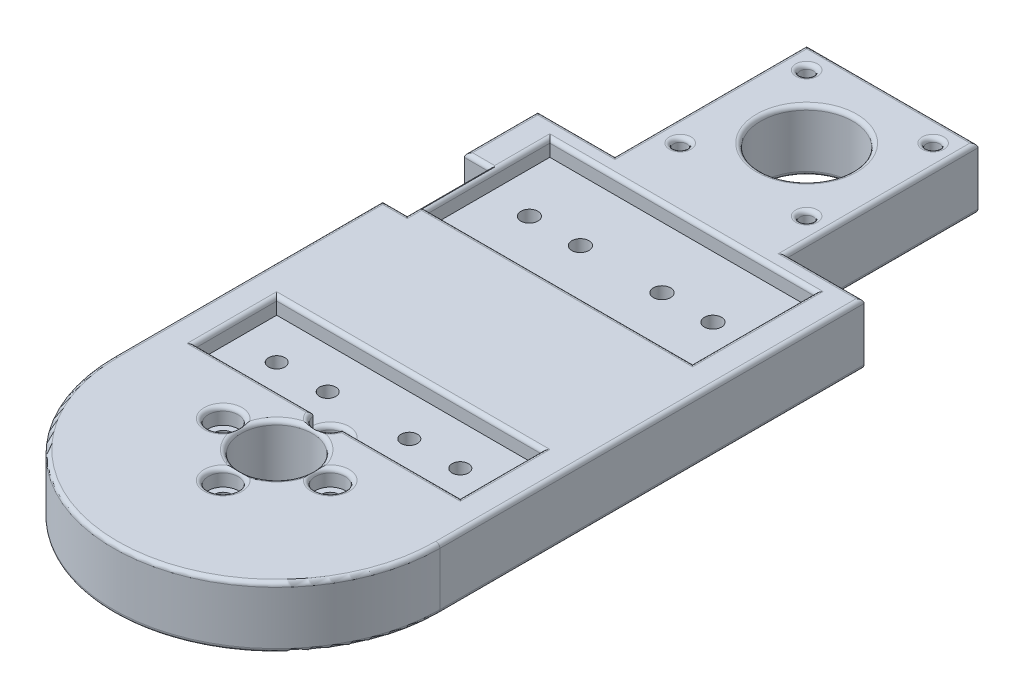
from build123d import *

# Parameters (mm, degrees)
SKIZZE1_W                        = 42
SKIZZE1_H                        = 47
SKIZZE1_R                        = 1.65
SKIZZE1_R_2                      = 11.3
SKIZZE1_R_3                      = 40
SKIZZE1_R_4                      = 17.5
SKIZZE1_R_5                      = 2.1
SKIZZE1_R_6                      = 8.75
AUFSATZ_LINEAR_AUSTRAGEN1_DEPTH  = 15
SCHNITT_LINEAR_AUSTRAGEN3_DEPTH  = 4
SKIZZE6_R                        = 2
SCHNITT_LINEAR_AUSTRAGEN4_DEPTH  = 11
SKIZZE14_W                       = 6
SKIZZE14_H                       = 20
SCHNITT_LINEAR_AUSTRAGEN11_DEPTH = 15
SKIZZE15_R                       = 2.25
SCHNITT_LINEAR_AUSTRAGEN12_DEPTH = 6
SKIZZE19_W                       = 65
SKIZZE19_H                       = 30
SCHNITT_LINEAR_AUSTRAGEN15_DEPTH = 4
SKIZZE21_R                       = 2.1
SCHNITT_LINEAR_AUSTRAGEN16_DEPTH = 11
SKIZZE22_R                       = 3.65
SCHNITT_LINEAR_AUSTRAGEN17_DEPTH = 4
SKIZZE23_R                       = 3
SKIZZE23_R_2                     = 11.3
SCHNITT_LINEAR_AUSTRAGEN18_DEPTH = 3
SKETCH5_R                        = 3.65
CUT_EXTRUDE3_DEPTH               = 4
SKIZZE24_R                       = 3.65
SCHNITT_LINEAR_AUSTRAGEN19_DEPTH = 4
VERRUNDUNG1_R                    = 1


with BuildPart() as part:
    # Skizze1 → Aufsatz-Linear austragen1 (new body)
    # profile 1 of 4: a face of its own
    with BuildSketch(Plane(origin=(0, 0, 0), x_dir=(1, 0, 0), z_dir=(0, 1, 0))):
        with Locations((-0.084777034, 127.5)):
            Rectangle(SKIZZE1_W, SKIZZE1_H)
        with Locations(Location((-15.584777034, 114.5, 0), (0, 0, 270))):
            Circle(SKIZZE1_R, mode=Mode.SUBTRACT)
        with Locations(Location((-15.584777034, 145.5, 0), (0, 0, 270))):
            Circle(SKIZZE1_R, mode=Mode.SUBTRACT)
        with Locations(Location((-0.084777034, 130, 0), (0, 0, 270))):
            Circle(SKIZZE1_R_2, mode=Mode.SUBTRACT)
        with Locations(Location((15.415222966, 114.5, 0), (0, 0, 270))):
            Circle(SKIZZE1_R, mode=Mode.SUBTRACT)
        with Locations(Location((15.415222966, 145.5, 0), (0, 0, 270))):
            Circle(SKIZZE1_R, mode=Mode.SUBTRACT)
    # profile 2 of 4: a face of its own
    with BuildSketch(Plane(origin=(0, 0, 0), x_dir=(1, 0, 0), z_dir=(0, 1, 0))):
        with BuildLine():
            Line((-40, 78), (-40, 0))
            ThreePointArc((-40, 0), (0, 40), (40, 0))
            Line((40, 0), (40, 104))
            Line((40, 104), (20.915222966, 104))
            Line((20.915222966, 104), (-21.084777034, 104))
            Line((-21.084777034, 104), (-40, 104))
            Line((-40, 104), (-40, 78))
        make_face()
    # profile 3 of 4: a face of its own
    with BuildSketch(Plane(origin=(0, 0, 0), x_dir=(1, 0, 0), z_dir=(0, 1, 0))):
        Circle(SKIZZE1_R_3)
        Circle(SKIZZE1_R_4, mode=Mode.SUBTRACT)
    # profile 4 of 4: a face of its own
    with BuildSketch(Plane(origin=(0, 0, 0), x_dir=(1, 0, 0), z_dir=(0, 1, 0))):
        Circle(SKIZZE1_R_4)
        with Locations(Location((-13.125, 0, 0), (0, 0, 270))):
            Circle(SKIZZE1_R_5, mode=Mode.SUBTRACT)
        with Locations(Location((0, -13.125, 0), (0, 0, 270))):
            Circle(SKIZZE1_R_5, mode=Mode.SUBTRACT)
        with Locations(Location((13.125, 0, 0), (0, 0, 270))):
            Circle(SKIZZE1_R_5, mode=Mode.SUBTRACT)
        with Locations(Location((0, 13.125, 0), (0, 0, 270))):
            Circle(SKIZZE1_R_5, mode=Mode.SUBTRACT)
        with Locations(Location((0, 0, 0), (0, 0, 270))):
            Circle(SKIZZE1_R_6, mode=Mode.SUBTRACT)
    extrude(amount=AUFSATZ_LINEAR_AUSTRAGEN1_DEPTH)

    # Skizze5 → Schnitt-Linear austragen3 (cut)
    with BuildSketch(Plane(origin=(0, 15, 0), x_dir=(1, 0, 0), z_dir=(0, 1, 0))):
        Polygon((32.5, 32.5), (-25, 32.5), (-32.5, 32.5), (-32.5, 12.5), (32.5, 12.5), align=None)
    extrude(amount=-SCHNITT_LINEAR_AUSTRAGEN3_DEPTH, mode=Mode.SUBTRACT)

    # Skizze6 → Schnitt-Linear austragen4 (cut)
    with BuildSketch(Plane(origin=(0, 11, 0), x_dir=(1, 0, 0), z_dir=(0, 1, 0))):
        with Locations(Location((10, 22.5, 0), (0, 0, 270))):
            Circle(SKIZZE6_R)
        with Locations(Location((-10, 22.5, 0), (0, 0, 90))):
            Circle(SKIZZE6_R)
        with Locations(Location((22.5, 22.5, 0), (0, 0, 270))):
            Circle(SKIZZE6_R)
        with Locations(Location((-22.5, 22.5, 0), (0, 0, 90))):
            Circle(SKIZZE6_R)
    extrude(amount=-SCHNITT_LINEAR_AUSTRAGEN4_DEPTH, mode=Mode.SUBTRACT)

    # Skizze14 → Schnitt-Linear austragen11 (cut)
    with BuildSketch(Plane(origin=(0, 15, 0), x_dir=(1, 0, 0), z_dir=(0, 1, 0))):
        with Locations((-37, 76)):
            Rectangle(SKIZZE14_W, SKIZZE14_H)
    extrude(amount=-SCHNITT_LINEAR_AUSTRAGEN11_DEPTH, mode=Mode.SUBTRACT)

    # Skizze15 → Schnitt-Linear austragen12 (cut)
    with BuildSketch(Plane.ZY.offset(34)):
        with Locations((-80.5, 7.5)):
            Circle(SKIZZE15_R)
        with Locations((-71, 7.5)):
            Circle(SKIZZE15_R)
    extrude(amount=-SCHNITT_LINEAR_AUSTRAGEN12_DEPTH, mode=Mode.SUBTRACT)

    # Skizze19 → Schnitt-Linear austragen15 (cut)
    with BuildSketch(Plane(origin=(0, 15, 0), x_dir=(1, 0, 0), z_dir=(0, 1, 0))):
        with Locations((-0.055105072, 84.5)):
            Rectangle(SKIZZE19_W, SKIZZE19_H)
    extrude(amount=-SCHNITT_LINEAR_AUSTRAGEN15_DEPTH, mode=Mode.SUBTRACT)

    # Skizze21 → Schnitt-Linear austragen16 (cut)
    with BuildSketch(Plane(origin=(0, 11, 0), x_dir=(1, 0, 0), z_dir=(0, 1, 0))):
        with Locations(Location((22.444894928, 84.5, 0), (0, 0, 270))):
            Circle(SKIZZE21_R)
        with Locations(Location((9.944894928, 84.5, 0), (0, 0, 270))):
            Circle(SKIZZE21_R)
        with Locations(Location((-22.554452941, 84.5, 0), (0, 0, 90))):
            Circle(SKIZZE21_R)
        with Locations(Location((-10.054452941, 84.5, 0), (0, 0, 90))):
            Circle(SKIZZE21_R)
    extrude(amount=-SCHNITT_LINEAR_AUSTRAGEN16_DEPTH, mode=Mode.SUBTRACT)

    # Skizze22 → Schnitt-Linear austragen17 (cut)
    with BuildSketch(Plane.XZ):
        with Locations(Location((-22.554452941, -84.5, 0), (0, 0, 270))):
            Circle(SKIZZE22_R)
        with Locations(Location((-10.054452941, -84.5, 0), (0, 0, 270))):
            Circle(SKIZZE22_R)
        with Locations(Location((10.054452941, -84.5, 0), (0, 0, 90))):
            Circle(SKIZZE22_R)
        with Locations(Location((22.554452941, -84.5, 0), (0, 0, 90))):
            Circle(SKIZZE22_R)
        with Locations(Location((-22.5, -22.5, 0), (0, 0, 270))):
            Circle(SKIZZE22_R)
        with Locations(Location((-10, -22.5, 0), (0, 0, 270))):
            Circle(SKIZZE22_R)
        with Locations(Location((10, -22.5, 0), (0, 0, 90))):
            Circle(SKIZZE22_R)
        with Locations(Location((22.5, -22.5, 0), (0, 0, 90))):
            Circle(SKIZZE22_R)
    extrude(amount=-SCHNITT_LINEAR_AUSTRAGEN17_DEPTH, mode=Mode.SUBTRACT)

    # Skizze23 → Schnitt-Linear austragen18 (cut)
    with BuildSketch(Plane.XZ):
        with Locations(Location((-15.584777034, -114.5, 0), (0, 0, 270))):
            Circle(SKIZZE23_R)
        with Locations(Location((-0.084777034, -130, 0), (0, 0, 90))):
            Circle(SKIZZE23_R_2)
        with Locations(Location((15.415222966, -114.5, 0), (0, 0, 270))):
            Circle(SKIZZE23_R)
        with Locations(Location((15.415222966, -145.5, 0), (0, 0, 270))):
            Circle(SKIZZE23_R)
        with Locations(Location((-15.584777034, -145.5, 0), (0, 0, 270))):
            Circle(SKIZZE23_R)
    extrude(amount=-SCHNITT_LINEAR_AUSTRAGEN18_DEPTH, mode=Mode.SUBTRACT)

    # Sketch5 → Cut-Extrude3 (cut)
    with BuildSketch(Plane(origin=(0, 15, 0), x_dir=(1, 0, 0), z_dir=(0, 1, 0))):
        with Locations(Location((-13.125, 0, 0), (0, 0, 270))):
            Circle(SKETCH5_R)
        with Locations((0, 13.125)):
            Circle(SKETCH5_R)
        with Locations(Location((13.125, 0, 0), (0, 0, 270))):
            Circle(SKETCH5_R)
        with Locations(Location((0, -13.125, 0), (0, 0, 270))):
            Circle(SKETCH5_R)
    extrude(amount=-CUT_EXTRUDE3_DEPTH, mode=Mode.SUBTRACT)

    # Skizze24 → Schnitt-Linear austragen19 (cut)
    with BuildSketch(Plane(origin=(0, 11, 0), x_dir=(1, 0, 0), z_dir=(0, 1, 0))):
        with Locations(Location((0, 13.125, 0), (0, 0, 270))):
            Circle(SKIZZE24_R)
    extrude(amount=-SCHNITT_LINEAR_AUSTRAGEN19_DEPTH, mode=Mode.SUBTRACT)

    # Verrundung1
    # the kernel refuses this fillet: 1 mm, written as the material it takes off along each edge
    with BuildSketch(Plane(origin=(0, 15, 0), x_dir=(0, 0, 1), z_dir=(-1, 0, 0))) as verrundung1_piece_1:
        with BuildLine():
            CenterArc((8.75 + VERRUNDUNG1_R, -VERRUNDUNG1_R), VERRUNDUNG1_R, 90, 90)
            Line((8.75, -VERRUNDUNG1_R), (8.75, 0))
            Line((8.75, 0), (8.75 + VERRUNDUNG1_R, 0))
        make_face()
    revolve(axis=Axis((0, 15, 0), (0, 1, 0)), mode=Mode.SUBTRACT)
    with BuildSketch(Plane(origin=(-40, 0, -106.5), x_dir=(1, 0, 0), z_dir=(0, 0, 1)), Plane(origin=(-40, 15, -83.5), x_dir=(1, 0, 0), z_dir=(0, 0, -1))) as verrundung1_piece_2:
        with BuildLine():
            CenterArc((VERRUNDUNG1_R, VERRUNDUNG1_R), VERRUNDUNG1_R, 180, 90)
            Line((0, VERRUNDUNG1_R), (0, 0))
            Line((0, 0), (VERRUNDUNG1_R, 0))
        make_face()
    extrude(amount=23, mode=Mode.SUBTRACT)
    with BuildSketch(Plane(origin=(-34, 0, -66), x_dir=(0, 0, 1), z_dir=(-1, 0, 0)), Plane(origin=(-42.5, 0, -86), x_dir=(0, 0, -1), z_dir=(1, 0, 0))) as verrundung1_piece_3:
        with BuildLine():
            CenterArc((VERRUNDUNG1_R, VERRUNDUNG1_R), VERRUNDUNG1_R, 180, 90)
            Line((0, VERRUNDUNG1_R), (0, 0))
            Line((0, 0), (VERRUNDUNG1_R, 0))
        make_face()
    extrude(amount=8.5, mode=Mode.SUBTRACT)
    with BuildSketch(Plane(origin=(-42.5, 15, -86), x_dir=(0, 0, -1), z_dir=(1, 0, 0)), Plane(origin=(-34, 15, -66), x_dir=(0, 0, 1), z_dir=(-1, 0, 0))) as verrundung1_piece_4:
        with BuildLine():
            CenterArc((VERRUNDUNG1_R, -VERRUNDUNG1_R), VERRUNDUNG1_R, 90, 90)
            Line((0, -VERRUNDUNG1_R), (0, 0))
            Line((0, 0), (VERRUNDUNG1_R, 0))
        make_face()
    extrude(amount=8.5, mode=Mode.SUBTRACT)
    with BuildSketch(Plane(origin=(-34, 15, -86), x_dir=(1, 0, 0), z_dir=(0, 0, 1))) as verrundung1_piece_5:
        with BuildLine():
            CenterArc((VERRUNDUNG1_R, -VERRUNDUNG1_R), VERRUNDUNG1_R, 90, 90)
            Line((0, -VERRUNDUNG1_R), (0, 0))
            Line((0, 0), (VERRUNDUNG1_R, 0))
        make_face()
    extrude(amount=20, mode=Mode.SUBTRACT)
    with BuildSketch(Plane(origin=(-34, 0, -86), x_dir=(1, 0, 0), z_dir=(0, 0, 1)), Plane(origin=(-32.5, 15, -32.5), x_dir=(-1, 0, 0), z_dir=(0, 0, 1)), Plane(origin=(32.5, 15, -12.5), x_dir=(1, 0, 0), z_dir=(0, 0, -1))) as verrundung1_piece_6:
        with BuildLine():
            CenterArc((VERRUNDUNG1_R, VERRUNDUNG1_R), VERRUNDUNG1_R, 180, 90)
            Line((0, VERRUNDUNG1_R), (0, 0))
            Line((0, 0), (VERRUNDUNG1_R, 0))
        make_face()
    extrude(amount=20, mode=Mode.SUBTRACT)
    with BuildSketch(Plane(origin=(32.444894928, 15, -69.5), x_dir=(1, 0, 0), z_dir=(0, 0, -1)), Plane(origin=(-32.555105072, 15, -99.5), x_dir=(-1, 0, 0), z_dir=(0, 0, 1))) as verrundung1_piece_7:
        with BuildLine():
            CenterArc((VERRUNDUNG1_R, VERRUNDUNG1_R), VERRUNDUNG1_R, 180, 90)
            Line((0, VERRUNDUNG1_R), (0, 0))
            Line((0, 0), (VERRUNDUNG1_R, 0))
        make_face()
    extrude(amount=30, mode=Mode.SUBTRACT)
    with BuildSketch(Plane(origin=(32.444894928, 15, -99.5), x_dir=(0, 0, -1), z_dir=(-1, 0, 0)), Plane(origin=(-32.555105072, 15, -69.5), x_dir=(0, 0, 1), z_dir=(1, 0, 0))) as verrundung1_piece_8:
        with BuildLine():
            CenterArc((VERRUNDUNG1_R, VERRUNDUNG1_R), VERRUNDUNG1_R, 180, 90)
            Line((0, VERRUNDUNG1_R), (0, 0))
            Line((0, 0), (VERRUNDUNG1_R, 0))
        make_face()
    extrude(amount=65, mode=Mode.SUBTRACT)
    with BuildSketch(Plane(origin=(-15.584777034, 15, -114.5), x_dir=(0, 0, 1), z_dir=(-1, 0, 0))) as verrundung1_piece_9:
        with BuildLine():
            CenterArc((1.65 + VERRUNDUNG1_R, -VERRUNDUNG1_R), VERRUNDUNG1_R, 90, 90)
            Line((1.65, -VERRUNDUNG1_R), (1.65, 0))
            Line((1.65, 0), (1.65 + VERRUNDUNG1_R, 0))
        make_face()
    revolve(axis=Axis((-15.584777034, 15, -114.5), (0, 1, 0)), mode=Mode.SUBTRACT)
    with BuildSketch(Plane(origin=(-22.5, 0, -22.5), x_dir=(0, 0, -1), z_dir=(-1, 0, 0))) as verrundung1_piece_10:
        with BuildLine():
            CenterArc((3.65 + VERRUNDUNG1_R, -VERRUNDUNG1_R), VERRUNDUNG1_R, 90, 90)
            Line((3.65, -VERRUNDUNG1_R), (3.65, 0))
            Line((3.65, 0), (3.65 + VERRUNDUNG1_R, 0))
        make_face()
    revolve(axis=Axis((-22.5, 0, -22.5), (0, -1, 0)), mode=Mode.SUBTRACT)
    with BuildSketch(Plane(origin=(22.554452941, 0, -84.5), x_dir=(0, 0, 1), z_dir=(1, 0, 0))) as verrundung1_piece_11:
        with BuildLine():
            CenterArc((3.65 + VERRUNDUNG1_R, -VERRUNDUNG1_R), VERRUNDUNG1_R, 90, 90)
            Line((3.65, -VERRUNDUNG1_R), (3.65, 0))
            Line((3.65, 0), (3.65 + VERRUNDUNG1_R, 0))
        make_face()
    revolve(axis=Axis((22.554452941, 0, -84.5), (0, -1, 0)), mode=Mode.SUBTRACT)
    with BuildSketch(Plane(origin=(10.054452941, 0, -84.5), x_dir=(0, 0, 1), z_dir=(1, 0, 0))) as verrundung1_piece_12:
        with BuildLine():
            CenterArc((3.65 + VERRUNDUNG1_R, -VERRUNDUNG1_R), VERRUNDUNG1_R, 90, 90)
            Line((3.65, -VERRUNDUNG1_R), (3.65, 0))
            Line((3.65, 0), (3.65 + VERRUNDUNG1_R, 0))
        make_face()
    revolve(axis=Axis((10.054452941, 0, -84.5), (0, -1, 0)), mode=Mode.SUBTRACT)
    with BuildSketch(Plane(origin=(15.415222966, 15, -114.5), x_dir=(0, 0, 1), z_dir=(-1, 0, 0))) as verrundung1_piece_13:
        with BuildLine():
            CenterArc((1.65 + VERRUNDUNG1_R, -VERRUNDUNG1_R), VERRUNDUNG1_R, 90, 90)
            Line((1.65, -VERRUNDUNG1_R), (1.65, 0))
            Line((1.65, 0), (1.65 + VERRUNDUNG1_R, 0))
        make_face()
    revolve(axis=Axis((15.415222966, 15, -114.5), (0, 1, 0)), mode=Mode.SUBTRACT)
    with BuildSketch(Plane(origin=(-10.054452941, 0, -84.5), x_dir=(0, 0, -1), z_dir=(-1, 0, 0))) as verrundung1_piece_14:
        with BuildLine():
            CenterArc((3.65 + VERRUNDUNG1_R, -VERRUNDUNG1_R), VERRUNDUNG1_R, 90, 90)
            Line((3.65, -VERRUNDUNG1_R), (3.65, 0))
            Line((3.65, 0), (3.65 + VERRUNDUNG1_R, 0))
        make_face()
    revolve(axis=Axis((-10.054452941, 0, -84.5), (0, -1, 0)), mode=Mode.SUBTRACT)
    with BuildSketch(Plane(origin=(-10, 0, -22.5), x_dir=(0, 0, -1), z_dir=(-1, 0, 0))) as verrundung1_piece_15:
        with BuildLine():
            CenterArc((3.65 + VERRUNDUNG1_R, -VERRUNDUNG1_R), VERRUNDUNG1_R, 90, 90)
            Line((3.65, -VERRUNDUNG1_R), (3.65, 0))
            Line((3.65, 0), (3.65 + VERRUNDUNG1_R, 0))
        make_face()
    revolve(axis=Axis((-10, 0, -22.5), (0, -1, 0)), mode=Mode.SUBTRACT)
    with BuildSketch(Plane(origin=(10, 0, -22.5), x_dir=(0, 0, 1), z_dir=(1, 0, 0))) as verrundung1_piece_16:
        with BuildLine():
            CenterArc((3.65 + VERRUNDUNG1_R, -VERRUNDUNG1_R), VERRUNDUNG1_R, 90, 90)
            Line((3.65, -VERRUNDUNG1_R), (3.65, 0))
            Line((3.65, 0), (3.65 + VERRUNDUNG1_R, 0))
        make_face()
    revolve(axis=Axis((10, 0, -22.5), (0, -1, 0)), mode=Mode.SUBTRACT)
    with BuildSketch(Plane(origin=(22.5, 0, -22.5), x_dir=(0, 0, 1), z_dir=(1, 0, 0))) as verrundung1_piece_17:
        with BuildLine():
            CenterArc((3.65 + VERRUNDUNG1_R, -VERRUNDUNG1_R), VERRUNDUNG1_R, 90, 90)
            Line((3.65, -VERRUNDUNG1_R), (3.65, 0))
            Line((3.65, 0), (3.65 + VERRUNDUNG1_R, 0))
        make_face()
    revolve(axis=Axis((22.5, 0, -22.5), (0, -1, 0)), mode=Mode.SUBTRACT)
    with BuildSketch(Plane(origin=(-22.554452941, 0, -84.5), x_dir=(0, 0, -1), z_dir=(-1, 0, 0))) as verrundung1_piece_18:
        with BuildLine():
            CenterArc((3.65 + VERRUNDUNG1_R, -VERRUNDUNG1_R), VERRUNDUNG1_R, 90, 90)
            Line((3.65, -VERRUNDUNG1_R), (3.65, 0))
            Line((3.65, 0), (3.65 + VERRUNDUNG1_R, 0))
        make_face()
    revolve(axis=Axis((-22.554452941, 0, -84.5), (0, -1, 0)), mode=Mode.SUBTRACT)
    with BuildSketch(Plane(origin=(0, 0, 0), x_dir=(0, 0, 1), z_dir=(-1, 0, 0))) as verrundung1_piece_19:
        with BuildLine():
            CenterArc((8.75 + VERRUNDUNG1_R, VERRUNDUNG1_R), VERRUNDUNG1_R, 180, 90)
            Line((8.75, VERRUNDUNG1_R), (8.75, 0))
            Line((8.75, 0), (8.75 + VERRUNDUNG1_R, 0))
        make_face()
    revolve(axis=Axis((0, 0, 0), (0, 1, 0)), mode=Mode.SUBTRACT)
    with BuildSketch(Plane(origin=(0, 0, -13.125), x_dir=(0, 0, 1), z_dir=(-1, 0, 0))) as verrundung1_piece_20:
        with BuildLine():
            CenterArc((2.1 + VERRUNDUNG1_R, VERRUNDUNG1_R), VERRUNDUNG1_R, 180, 90)
            Line((2.1, VERRUNDUNG1_R), (2.1, 0))
            Line((2.1, 0), (2.1 + VERRUNDUNG1_R, 0))
        make_face()
    revolve(axis=Axis((0, 0, -13.125), (0, 1, 0)), mode=Mode.SUBTRACT)
    with BuildSketch(Plane(origin=(13.125, 0, 0), x_dir=(0, 0, 1), z_dir=(-1, 0, 0))) as verrundung1_piece_21:
        with BuildLine():
            CenterArc((2.1 + VERRUNDUNG1_R, VERRUNDUNG1_R), VERRUNDUNG1_R, 180, 90)
            Line((2.1, VERRUNDUNG1_R), (2.1, 0))
            Line((2.1, 0), (2.1 + VERRUNDUNG1_R, 0))
        make_face()
    revolve(axis=Axis((13.125, 0, 0), (0, 1, 0)), mode=Mode.SUBTRACT)
    with BuildSketch(Plane(origin=(0, 0, 13.125), x_dir=(0, 0, 1), z_dir=(-1, 0, 0))) as verrundung1_piece_22:
        with BuildLine():
            CenterArc((2.1 + VERRUNDUNG1_R, VERRUNDUNG1_R), VERRUNDUNG1_R, 180, 90)
            Line((2.1, VERRUNDUNG1_R), (2.1, 0))
            Line((2.1, 0), (2.1 + VERRUNDUNG1_R, 0))
        make_face()
    revolve(axis=Axis((0, 0, 13.125), (0, 1, 0)), mode=Mode.SUBTRACT)
    with BuildSketch(Plane(origin=(-13.125, 0, 0), x_dir=(0, 0, 1), z_dir=(-1, 0, 0))) as verrundung1_piece_23:
        with BuildLine():
            CenterArc((2.1 + VERRUNDUNG1_R, VERRUNDUNG1_R), VERRUNDUNG1_R, 180, 90)
            Line((2.1, VERRUNDUNG1_R), (2.1, 0))
            Line((2.1, 0), (2.1 + VERRUNDUNG1_R, 0))
        make_face()
    revolve(axis=Axis((-13.125, 0, 0), (0, 1, 0)), mode=Mode.SUBTRACT)
    with BuildSketch(Plane(origin=(23.415222966, 0, -151), x_dir=(0, 0, 1), z_dir=(-1, 0, 0))) as verrundung1_piece_24:
        with BuildLine():
            CenterArc((VERRUNDUNG1_R, VERRUNDUNG1_R), VERRUNDUNG1_R, 180, 90)
            Line((0, VERRUNDUNG1_R), (0, 0))
            Line((0, 0), (VERRUNDUNG1_R, 0))
        make_face()
    extrude(amount=47, mode=Mode.SUBTRACT)
    with BuildSketch(Plane(origin=(-15.584777034, 0, -145.5), x_dir=(0, 0, -1), z_dir=(-1, 0, 0))) as verrundung1_piece_25:
        with BuildLine():
            CenterArc((3 + VERRUNDUNG1_R, -VERRUNDUNG1_R), VERRUNDUNG1_R, 90, 90)
            Line((3, -VERRUNDUNG1_R), (3, 0))
            Line((3, 0), (3 + VERRUNDUNG1_R, 0))
        make_face()
    revolve(axis=Axis((-15.584777034, 0, -145.5), (0, -1, 0)), mode=Mode.SUBTRACT)
    with BuildSketch(Plane(origin=(15.415222966, 0, -145.5), x_dir=(0, 0, -1), z_dir=(-1, 0, 0))) as verrundung1_piece_26:
        with BuildLine():
            CenterArc((3 + VERRUNDUNG1_R, -VERRUNDUNG1_R), VERRUNDUNG1_R, 90, 90)
            Line((3, -VERRUNDUNG1_R), (3, 0))
            Line((3, 0), (3 + VERRUNDUNG1_R, 0))
        make_face()
    revolve(axis=Axis((15.415222966, 0, -145.5), (0, -1, 0)), mode=Mode.SUBTRACT)
    with BuildSketch(Plane(origin=(20.915222966, 0, -104), x_dir=(-1, 0, 0), z_dir=(0, 0, -1)), Plane(origin=(-21.084777034, 0, -153.5), x_dir=(1, 0, 0), z_dir=(0, 0, 1))) as verrundung1_piece_27:
        with BuildLine():
            CenterArc((VERRUNDUNG1_R, VERRUNDUNG1_R), VERRUNDUNG1_R, 180, 90)
            Line((0, VERRUNDUNG1_R), (0, 0))
            Line((0, 0), (VERRUNDUNG1_R, 0))
        make_face()
    extrude(amount=49.5, mode=Mode.SUBTRACT)
    with BuildSketch(Plane(origin=(15.415222966, 0, -114.5), x_dir=(0, 0, -1), z_dir=(-1, 0, 0))) as verrundung1_piece_28:
        with BuildLine():
            CenterArc((3 + VERRUNDUNG1_R, -VERRUNDUNG1_R), VERRUNDUNG1_R, 90, 90)
            Line((3, -VERRUNDUNG1_R), (3, 0))
            Line((3, 0), (3 + VERRUNDUNG1_R, 0))
        make_face()
    revolve(axis=Axis((15.415222966, 0, -114.5), (0, -1, 0)), mode=Mode.SUBTRACT)
    with BuildSketch(Plane(origin=(15.415222966, 15, -145.5), x_dir=(0, 0, 1), z_dir=(-1, 0, 0))) as verrundung1_piece_29:
        with BuildLine():
            CenterArc((1.65 + VERRUNDUNG1_R, -VERRUNDUNG1_R), VERRUNDUNG1_R, 90, 90)
            Line((1.65, -VERRUNDUNG1_R), (1.65, 0))
            Line((1.65, 0), (1.65 + VERRUNDUNG1_R, 0))
        make_face()
    revolve(axis=Axis((15.415222966, 15, -145.5), (0, 1, 0)), mode=Mode.SUBTRACT)
    with BuildSketch(Plane(origin=(42.5, 0, -104), x_dir=(0, 1, 0), z_dir=(-1, 0, 0)), Plane(origin=(20.915222966, 15, -104), x_dir=(0, -1, 0), z_dir=(1, 0, 0))) as verrundung1_piece_30:
        with BuildLine():
            CenterArc((VERRUNDUNG1_R, -VERRUNDUNG1_R), VERRUNDUNG1_R, 90, 90)
            Line((0, -VERRUNDUNG1_R), (0, 0))
            Line((0, 0), (VERRUNDUNG1_R, 0))
        make_face()
    extrude(amount=21.584777034, mode=Mode.SUBTRACT)
    with BuildSketch(Plane(origin=(-15.584777034, 0, -114.5), x_dir=(0, 0, -1), z_dir=(-1, 0, 0))) as verrundung1_piece_31:
        with BuildLine():
            CenterArc((3 + VERRUNDUNG1_R, -VERRUNDUNG1_R), VERRUNDUNG1_R, 90, 90)
            Line((3, -VERRUNDUNG1_R), (3, 0))
            Line((3, 0), (3 + VERRUNDUNG1_R, 0))
        make_face()
    revolve(axis=Axis((-15.584777034, 0, -114.5), (0, -1, 0)), mode=Mode.SUBTRACT)
    with BuildSketch(Plane(origin=(40, 0, 0), x_dir=(0, 1, 0), z_dir=(0, 0, -1))) as verrundung1_piece_32:
        with BuildLine():
            CenterArc((VERRUNDUNG1_R, -VERRUNDUNG1_R), VERRUNDUNG1_R, 90, 90)
            Line((0, -VERRUNDUNG1_R), (0, 0))
            Line((0, 0), (VERRUNDUNG1_R, 0))
        make_face()
    extrude(amount=106.5, mode=Mode.SUBTRACT)
    with BuildSketch(Plane(origin=(0, 0, 0), x_dir=(-1, 0, 0), z_dir=(0, 0, -1))) as verrundung1_piece_33:
        with BuildLine():
            CenterArc((40 - VERRUNDUNG1_R, VERRUNDUNG1_R), VERRUNDUNG1_R, 270, 90)
            Line((40 - VERRUNDUNG1_R, 0), (40, 0))
            Line((40, 0), (40, VERRUNDUNG1_R))
        make_face()
    revolve(axis=Axis((0, 0, 0), (0, 1, 0)), revolution_arc=180, mode=Mode.SUBTRACT)
    with BuildSketch(Plane(origin=(-40, 0, -68.5), x_dir=(1, 0, 0), z_dir=(0, 0, 1)), Plane(origin=(-40, 15, 0), x_dir=(1, 0, 0), z_dir=(0, 0, -1))) as verrundung1_piece_34:
        with BuildLine():
            CenterArc((VERRUNDUNG1_R, VERRUNDUNG1_R), VERRUNDUNG1_R, 180, 90)
            Line((0, VERRUNDUNG1_R), (0, 0))
            Line((0, 0), (VERRUNDUNG1_R, 0))
        make_face()
    extrude(amount=68.5, mode=Mode.SUBTRACT)
    with BuildSketch(Plane(origin=(1.096091628, 15, -12.5), x_dir=(0, 0, 1), z_dir=(1, 0, 0)), Plane(origin=(-32.5, 15, -12.5), x_dir=(0, 0, 1), z_dir=(1, 0, 0))) as verrundung1_piece_35:
        with BuildLine():
            CenterArc((VERRUNDUNG1_R, VERRUNDUNG1_R), VERRUNDUNG1_R, 180, 90)
            Line((0, VERRUNDUNG1_R), (0, 0))
            Line((0, 0), (VERRUNDUNG1_R, 0))
        make_face()
    extrude(amount=31.403908372, mode=Mode.SUBTRACT)
    with BuildSketch(Plane(origin=(-21.084777034, 0, -104), x_dir=(0, 0, 1), z_dir=(-1, 0, 0)), Plane(origin=(-42.5, 15, -104), x_dir=(0, 0, 1), z_dir=(1, 0, 0))) as verrundung1_piece_36:
        with BuildLine():
            CenterArc((VERRUNDUNG1_R, VERRUNDUNG1_R), VERRUNDUNG1_R, 180, 90)
            Line((0, VERRUNDUNG1_R), (0, 0))
            Line((0, 0), (VERRUNDUNG1_R, 0))
        make_face()
    extrude(amount=21.415222966, mode=Mode.SUBTRACT)
    with BuildSketch(Plane(origin=(-13.125, 15, 0), x_dir=(0, 0, 1), z_dir=(-1, 0, 0))) as verrundung1_piece_37:
        with BuildLine():
            CenterArc((3.65 + VERRUNDUNG1_R, -VERRUNDUNG1_R), VERRUNDUNG1_R, 90, 90)
            Line((3.65, -VERRUNDUNG1_R), (3.65, 0))
            Line((3.65, 0), (3.65 + VERRUNDUNG1_R, 0))
        make_face()
    revolve(axis=Axis((-13.125, 15, 0), (0, 1, 0)), mode=Mode.SUBTRACT)
    with BuildSketch(Plane(origin=(0, 15, -13.125), x_dir=(-0.8709205906379706, 0, -0.4914237731355783), z_dir=(0.4914237731355783, 0, -0.8709205906379706))) as verrundung1_piece_38:
        with BuildLine():
            CenterArc((3.65 + VERRUNDUNG1_R, -VERRUNDUNG1_R), VERRUNDUNG1_R, 90, 90)
            Line((3.65, -VERRUNDUNG1_R), (3.65, 0))
            Line((3.65, 0), (3.65 + VERRUNDUNG1_R, 0))
        make_face()
    revolve(axis=Axis((0, 15, -13.125), (0, 1, 0)), revolution_arc=238.868410159, mode=Mode.SUBTRACT)
    with BuildSketch(Plane(origin=(-0.084777034, 0, -130), x_dir=(0, 0, 1), z_dir=(-1, 0, 0))) as verrundung1_piece_39:
        with BuildLine():
            CenterArc((11.3 + VERRUNDUNG1_R, VERRUNDUNG1_R), VERRUNDUNG1_R, 180, 90)
            Line((11.3, VERRUNDUNG1_R), (11.3, 0))
            Line((11.3, 0), (11.3 + VERRUNDUNG1_R, 0))
        make_face()
    revolve(axis=Axis((-0.084777034, 0, -130), (0, 1, 0)), mode=Mode.SUBTRACT)
    with BuildSketch(Plane(origin=(13.125, 15, 0), x_dir=(0, 0, 1), z_dir=(-1, 0, 0))) as verrundung1_piece_40:
        with BuildLine():
            CenterArc((3.65 + VERRUNDUNG1_R, -VERRUNDUNG1_R), VERRUNDUNG1_R, 90, 90)
            Line((3.65, -VERRUNDUNG1_R), (3.65, 0))
            Line((3.65, 0), (3.65 + VERRUNDUNG1_R, 0))
        make_face()
    revolve(axis=Axis((13.125, 15, 0), (0, 1, 0)), mode=Mode.SUBTRACT)
    with BuildSketch(Plane(origin=(0, 15, 13.125), x_dir=(0, 0, 1), z_dir=(-1, 0, 0))) as verrundung1_piece_41:
        with BuildLine():
            CenterArc((3.65 + VERRUNDUNG1_R, -VERRUNDUNG1_R), VERRUNDUNG1_R, 90, 90)
            Line((3.65, -VERRUNDUNG1_R), (3.65, 0))
            Line((3.65, 0), (3.65 + VERRUNDUNG1_R, 0))
        make_face()
    revolve(axis=Axis((0, 15, 13.125), (0, 1, 0)), mode=Mode.SUBTRACT)
    with BuildSketch(Plane(origin=(-15.584777034, 15, -145.5), x_dir=(0, 0, 1), z_dir=(-1, 0, 0))) as verrundung1_piece_42:
        with BuildLine():
            CenterArc((1.65 + VERRUNDUNG1_R, -VERRUNDUNG1_R), VERRUNDUNG1_R, 90, 90)
            Line((1.65, -VERRUNDUNG1_R), (1.65, 0))
            Line((1.65, 0), (1.65 + VERRUNDUNG1_R, 0))
        make_face()
    revolve(axis=Axis((-15.584777034, 15, -145.5), (0, 1, 0)), mode=Mode.SUBTRACT)
    with BuildSketch(Plane(origin=(0, 11, -13.125), x_dir=(0.6536727855523831, 0, 0.7567773050430279), z_dir=(-0.7567773050430279, 0, 0.6536727855523831))) as verrundung1_piece_43_section:
        with BuildLine():
            CenterArc((3.65 + VERRUNDUNG1_R, -VERRUNDUNG1_R), VERRUNDUNG1_R, 90, 90)
            Line((3.65 + VERRUNDUNG1_R, 0), (3.65, 0))
            Line((3.65, 0), (3.65, -VERRUNDUNG1_R))
        make_face()
    verrundung1_piece_43 = revolve(axis=Axis((0, 11, -13.125), (0, 1, 0)), revolution_arc=278.361820048, mode=Mode.PRIVATE)
    verrundung1_piece_43 = split(verrundung1_piece_43, bisect_by=Plane(origin=(0, 10.717766134, -12.5), z_dir=(0, 0, -1)), keep=Keep.TOP, mode=Mode.PRIVATE)
    add(verrundung1_piece_43, mode=Mode.SUBTRACT)
    with BuildSketch(Plane(origin=(-0.084777034, 15, -130), x_dir=(0, 0, 1), z_dir=(-1, 0, 0))) as verrundung1_piece_44:
        with BuildLine():
            CenterArc((11.3 + VERRUNDUNG1_R, -VERRUNDUNG1_R), VERRUNDUNG1_R, 90, 90)
            Line((11.3, -VERRUNDUNG1_R), (11.3, 0))
            Line((11.3, 0), (11.3 + VERRUNDUNG1_R, 0))
        make_face()
    revolve(axis=Axis((-0.084777034, 15, -130), (0, 1, 0)), mode=Mode.SUBTRACT)
    with BuildSketch(Plane(origin=(-21.084777034, 15, -153.5), x_dir=(1, 0, 0), z_dir=(0, 0, 1)), Plane(origin=(20.915222966, 15, -104), x_dir=(-1, 0, 0), z_dir=(0, 0, -1))) as verrundung1_piece_45:
        with BuildLine():
            CenterArc((VERRUNDUNG1_R, -VERRUNDUNG1_R), VERRUNDUNG1_R, 90, 90)
            Line((0, -VERRUNDUNG1_R), (0, 0))
            Line((0, 0), (VERRUNDUNG1_R, 0))
        make_face()
    extrude(amount=49.5, mode=Mode.SUBTRACT)
    with BuildSketch(Plane(origin=(0, 15, 0), x_dir=(-1, 0, 0), z_dir=(0, 0, -1))) as verrundung1_piece_46:
        with BuildLine():
            CenterArc((40 - VERRUNDUNG1_R, -VERRUNDUNG1_R), VERRUNDUNG1_R, 0, 90)
            Line((40 - VERRUNDUNG1_R, 0), (40, 0))
            Line((40, 0), (40, -VERRUNDUNG1_R))
        make_face()
    revolve(axis=Axis((0, 15, 0), (0, 1, 0)), revolution_arc=180, mode=Mode.SUBTRACT)
    with BuildSketch(Plane(origin=(40, 15, 0), x_dir=(0, -1, 0), z_dir=(0, 0, -1))) as verrundung1_piece_47:
        with BuildLine():
            CenterArc((VERRUNDUNG1_R, VERRUNDUNG1_R), VERRUNDUNG1_R, 180, 90)
            Line((0, VERRUNDUNG1_R), (0, 0))
            Line((0, 0), (VERRUNDUNG1_R, 0))
        make_face()
    extrude(amount=106.5, mode=Mode.SUBTRACT)
    with BuildSketch(Plane(origin=(-32.5, 15, -32.5), x_dir=(0, 0, -1), z_dir=(1, 0, 0))) as verrundung1_piece_48:
        with BuildLine():
            CenterArc((VERRUNDUNG1_R, -VERRUNDUNG1_R), VERRUNDUNG1_R, 90, 90)
            Line((0, -VERRUNDUNG1_R), (0, 0))
            Line((0, 0), (VERRUNDUNG1_R, 0))
        make_face()
    extrude(amount=65, mode=Mode.SUBTRACT)
    with BuildSketch(Plane(origin=(23.415222966, 15, -151), x_dir=(0, 0, 1), z_dir=(-1, 0, 0))) as verrundung1_piece_49:
        with BuildLine():
            CenterArc((VERRUNDUNG1_R, -VERRUNDUNG1_R), VERRUNDUNG1_R, 90, 90)
            Line((0, -VERRUNDUNG1_R), (0, 0))
            Line((0, 0), (VERRUNDUNG1_R, 0))
        make_face()
    extrude(amount=47, mode=Mode.SUBTRACT)
    with BuildSketch(Plane(origin=(-31.5, 0, -66), x_dir=(0, 0, 1), z_dir=(-1, 0, 0))) as verrundung1_piece_50a_section:
        with BuildLine():
            CenterArc((VERRUNDUNG1_R, VERRUNDUNG1_R), VERRUNDUNG1_R, 180, 90)
            Line((0, VERRUNDUNG1_R), (0, 0))
            Line((0, 0), (VERRUNDUNG1_R, 0))
        make_face()
    verrundung1_piece_50a = extrude(amount=11, mode=Mode.PRIVATE)
    verrundung1_piece_50a = split(verrundung1_piece_50a, bisect_by=Plane(origin=(-34, 0.226395114, -65.773604886), z_dir=(1, 0, 0)), keep=Keep.TOP, mode=Mode.PRIVATE)
    with BuildSketch(Plane(origin=(-34, 0, -86), x_dir=(1, 0, 0), z_dir=(0, 0, 1))) as verrundung1_piece_50b_section:
        with BuildLine():
            CenterArc((VERRUNDUNG1_R, VERRUNDUNG1_R), VERRUNDUNG1_R, 180, 90)
            Line((0, VERRUNDUNG1_R), (0, 0))
            Line((0, 0), (VERRUNDUNG1_R, 0))
        make_face()
    verrundung1_piece_50b = extrude(amount=22.5, mode=Mode.PRIVATE)
    verrundung1_piece_50b = split(verrundung1_piece_50b, bisect_by=Plane(origin=(-33.773604886, 0.226395114, -66), z_dir=(0, 0, 1)), keep=Keep.TOP, mode=Mode.PRIVATE)
    verrundung1_piece_50 = verrundung1_piece_50a & verrundung1_piece_50b
    add(verrundung1_piece_50, mode=Mode.SUBTRACT)
    with BuildSketch(Plane(origin=(-34, 15, -88.5), x_dir=(1, 0, 0), z_dir=(0, 0, 1))) as verrundung1_piece_51a_section:
        with BuildLine():
            CenterArc((VERRUNDUNG1_R, -VERRUNDUNG1_R), VERRUNDUNG1_R, 90, 90)
            Line((0, -VERRUNDUNG1_R), (0, 0))
            Line((0, 0), (VERRUNDUNG1_R, 0))
        make_face()
    verrundung1_piece_51a = extrude(amount=22.5, mode=Mode.PRIVATE)
    verrundung1_piece_51a = split(verrundung1_piece_51a, bisect_by=Plane(origin=(-33.773604886, 14.773604886, -86), z_dir=(0, 0, -1)), keep=Keep.TOP, mode=Mode.PRIVATE)
    with BuildSketch(Plane(origin=(-42.5, 15, -86), x_dir=(0, 0, -1), z_dir=(1, 0, 0))) as verrundung1_piece_51b_section:
        with BuildLine():
            CenterArc((VERRUNDUNG1_R, -VERRUNDUNG1_R), VERRUNDUNG1_R, 90, 90)
            Line((0, -VERRUNDUNG1_R), (0, 0))
            Line((0, 0), (VERRUNDUNG1_R, 0))
        make_face()
    verrundung1_piece_51b = extrude(amount=11, mode=Mode.PRIVATE)
    verrundung1_piece_51b = split(verrundung1_piece_51b, bisect_by=Plane(origin=(-34, 14.773604886, -86.226395114), z_dir=(1, 0, 0)), keep=Keep.TOP, mode=Mode.PRIVATE)
    verrundung1_piece_51 = verrundung1_piece_51a & verrundung1_piece_51b
    add(verrundung1_piece_51, mode=Mode.SUBTRACT)
    with BuildSketch(Plane(origin=(-31.5, 15, -66), x_dir=(0, 0, 1), z_dir=(-1, 0, 0))) as verrundung1_piece_52a_section:
        with BuildLine():
            CenterArc((VERRUNDUNG1_R, -VERRUNDUNG1_R), VERRUNDUNG1_R, 90, 90)
            Line((0, -VERRUNDUNG1_R), (0, 0))
            Line((0, 0), (VERRUNDUNG1_R, 0))
        make_face()
    verrundung1_piece_52a = extrude(amount=11, mode=Mode.PRIVATE)
    verrundung1_piece_52a = split(verrundung1_piece_52a, bisect_by=Plane(origin=(-34, 14.773604886, -65.773604886), z_dir=(1, 0, 0)), keep=Keep.TOP, mode=Mode.PRIVATE)
    with BuildSketch(Plane(origin=(-34, 15, -86), x_dir=(1, 0, 0), z_dir=(0, 0, 1))) as verrundung1_piece_52b_section:
        with BuildLine():
            CenterArc((VERRUNDUNG1_R, -VERRUNDUNG1_R), VERRUNDUNG1_R, 90, 90)
            Line((0, -VERRUNDUNG1_R), (0, 0))
            Line((0, 0), (VERRUNDUNG1_R, 0))
        make_face()
    verrundung1_piece_52b = extrude(amount=22.5, mode=Mode.PRIVATE)
    verrundung1_piece_52b = split(verrundung1_piece_52b, bisect_by=Plane(origin=(-33.773604886, 14.773604886, -66), z_dir=(0, 0, 1)), keep=Keep.TOP, mode=Mode.PRIVATE)
    verrundung1_piece_52 = verrundung1_piece_52a & verrundung1_piece_52b
    add(verrundung1_piece_52, mode=Mode.SUBTRACT)
    with BuildSketch(Plane(origin=(-34, 0, -88.5), x_dir=(1, 0, 0), z_dir=(0, 0, 1))) as verrundung1_piece_53a_section:
        with BuildLine():
            CenterArc((VERRUNDUNG1_R, VERRUNDUNG1_R), VERRUNDUNG1_R, 180, 90)
            Line((0, VERRUNDUNG1_R), (0, 0))
            Line((0, 0), (VERRUNDUNG1_R, 0))
        make_face()
    verrundung1_piece_53a = extrude(amount=22.5, mode=Mode.PRIVATE)
    verrundung1_piece_53a = split(verrundung1_piece_53a, bisect_by=Plane(origin=(-33.773604886, 0.226395114, -86), z_dir=(0, 0, -1)), keep=Keep.TOP, mode=Mode.PRIVATE)
    with BuildSketch(Plane(origin=(-42.5, 0, -86), x_dir=(0, 0, -1), z_dir=(1, 0, 0))) as verrundung1_piece_53b_section:
        with BuildLine():
            CenterArc((VERRUNDUNG1_R, VERRUNDUNG1_R), VERRUNDUNG1_R, 180, 90)
            Line((0, VERRUNDUNG1_R), (0, 0))
            Line((0, 0), (VERRUNDUNG1_R, 0))
        make_face()
    verrundung1_piece_53b = extrude(amount=11, mode=Mode.PRIVATE)
    verrundung1_piece_53b = split(verrundung1_piece_53b, bisect_by=Plane(origin=(-34, 0.226395114, -86.226395114), z_dir=(1, 0, 0)), keep=Keep.TOP, mode=Mode.PRIVATE)
    verrundung1_piece_53 = verrundung1_piece_53a & verrundung1_piece_53b
    add(verrundung1_piece_53, mode=Mode.SUBTRACT)
    with BuildSketch(Plane(origin=(-32.555105072, 15, -69.5), x_dir=(0, 0, 1), z_dir=(1, 0, 0))) as verrundung1_piece_54a_section:
        with BuildLine():
            CenterArc((VERRUNDUNG1_R, VERRUNDUNG1_R), VERRUNDUNG1_R, 180, 90)
            Line((0, VERRUNDUNG1_R), (0, 0))
            Line((0, 0), (VERRUNDUNG1_R, 0))
        make_face()
    verrundung1_piece_54a = extrude(amount=67.5, mode=Mode.PRIVATE)
    verrundung1_piece_54a = split(verrundung1_piece_54a, bisect_by=Plane(origin=(32.444894928, 14.773604886, -69.273604886), z_dir=(1, 0, 0)), keep=Keep.TOP, mode=Mode.PRIVATE)
    with BuildSketch(Plane(origin=(32.444894928, 15, -67), x_dir=(1, 0, 0), z_dir=(0, 0, -1))) as verrundung1_piece_54b_section:
        with BuildLine():
            CenterArc((VERRUNDUNG1_R, VERRUNDUNG1_R), VERRUNDUNG1_R, 180, 90)
            Line((0, VERRUNDUNG1_R), (0, 0))
            Line((0, 0), (VERRUNDUNG1_R, 0))
        make_face()
    verrundung1_piece_54b = extrude(amount=32.5, mode=Mode.PRIVATE)
    verrundung1_piece_54b = split(verrundung1_piece_54b, bisect_by=Plane(origin=(32.671290042, 14.773604886, -69.5), z_dir=(0, 0, 1)), keep=Keep.TOP, mode=Mode.PRIVATE)
    verrundung1_piece_54 = verrundung1_piece_54a & verrundung1_piece_54b
    add(verrundung1_piece_54, mode=Mode.SUBTRACT)
    with BuildSketch(Plane(origin=(32.444894928, 15, -69.5), x_dir=(1, 0, 0), z_dir=(0, 0, -1))) as verrundung1_piece_55a_section:
        with BuildLine():
            CenterArc((VERRUNDUNG1_R, VERRUNDUNG1_R), VERRUNDUNG1_R, 180, 90)
            Line((0, VERRUNDUNG1_R), (0, 0))
            Line((0, 0), (VERRUNDUNG1_R, 0))
        make_face()
    verrundung1_piece_55a = extrude(amount=32.5, mode=Mode.PRIVATE)
    verrundung1_piece_55a = split(verrundung1_piece_55a, bisect_by=Plane(origin=(32.671290042, 14.773604886, -99.5), z_dir=(0, 0, -1)), keep=Keep.TOP, mode=Mode.PRIVATE)
    with BuildSketch(Plane(origin=(34.944894928, 15, -99.5), x_dir=(0, 0, -1), z_dir=(-1, 0, 0))) as verrundung1_piece_55b_section:
        with BuildLine():
            CenterArc((VERRUNDUNG1_R, VERRUNDUNG1_R), VERRUNDUNG1_R, 180, 90)
            Line((0, VERRUNDUNG1_R), (0, 0))
            Line((0, 0), (VERRUNDUNG1_R, 0))
        make_face()
    verrundung1_piece_55b = extrude(amount=67.5, mode=Mode.PRIVATE)
    verrundung1_piece_55b = split(verrundung1_piece_55b, bisect_by=Plane(origin=(32.444894928, 14.773604886, -99.726395114), z_dir=(1, 0, 0)), keep=Keep.TOP, mode=Mode.PRIVATE)
    verrundung1_piece_55 = verrundung1_piece_55a & verrundung1_piece_55b
    add(verrundung1_piece_55, mode=Mode.SUBTRACT)
    with BuildSketch(Plane(origin=(-32.555105072, 15, -102), x_dir=(-1, 0, 0), z_dir=(0, 0, 1))) as verrundung1_piece_56a_section:
        with BuildLine():
            CenterArc((VERRUNDUNG1_R, VERRUNDUNG1_R), VERRUNDUNG1_R, 180, 90)
            Line((0, VERRUNDUNG1_R), (0, 0))
            Line((0, 0), (VERRUNDUNG1_R, 0))
        make_face()
    verrundung1_piece_56a = extrude(amount=32.5, mode=Mode.PRIVATE)
    verrundung1_piece_56a = split(verrundung1_piece_56a, bisect_by=Plane(origin=(-32.781500186, 14.773604886, -99.5), z_dir=(0, 0, -1)), keep=Keep.TOP, mode=Mode.PRIVATE)
    with BuildSketch(Plane(origin=(32.444894928, 15, -99.5), x_dir=(0, 0, -1), z_dir=(-1, 0, 0))) as verrundung1_piece_56b_section:
        with BuildLine():
            CenterArc((VERRUNDUNG1_R, VERRUNDUNG1_R), VERRUNDUNG1_R, 180, 90)
            Line((0, VERRUNDUNG1_R), (0, 0))
            Line((0, 0), (VERRUNDUNG1_R, 0))
        make_face()
    verrundung1_piece_56b = extrude(amount=67.5, mode=Mode.PRIVATE)
    verrundung1_piece_56b = split(verrundung1_piece_56b, bisect_by=Plane(origin=(-32.555105072, 14.773604886, -99.726395114), z_dir=(-1, 0, 0)), keep=Keep.TOP, mode=Mode.PRIVATE)
    verrundung1_piece_56 = verrundung1_piece_56a & verrundung1_piece_56b
    add(verrundung1_piece_56, mode=Mode.SUBTRACT)
    with BuildSketch(Plane(origin=(-35.055105072, 15, -69.5), x_dir=(0, 0, 1), z_dir=(1, 0, 0))) as verrundung1_piece_57a_section:
        with BuildLine():
            CenterArc((VERRUNDUNG1_R, VERRUNDUNG1_R), VERRUNDUNG1_R, 180, 90)
            Line((0, VERRUNDUNG1_R), (0, 0))
            Line((0, 0), (VERRUNDUNG1_R, 0))
        make_face()
    verrundung1_piece_57a = extrude(amount=67.5, mode=Mode.PRIVATE)
    verrundung1_piece_57a = split(verrundung1_piece_57a, bisect_by=Plane(origin=(-32.555105072, 14.773604886, -69.273604886), z_dir=(-1, 0, 0)), keep=Keep.TOP, mode=Mode.PRIVATE)
    with BuildSketch(Plane(origin=(-32.555105072, 15, -99.5), x_dir=(-1, 0, 0), z_dir=(0, 0, 1))) as verrundung1_piece_57b_section:
        with BuildLine():
            CenterArc((VERRUNDUNG1_R, VERRUNDUNG1_R), VERRUNDUNG1_R, 180, 90)
            Line((0, VERRUNDUNG1_R), (0, 0))
            Line((0, 0), (VERRUNDUNG1_R, 0))
        make_face()
    verrundung1_piece_57b = extrude(amount=32.5, mode=Mode.PRIVATE)
    verrundung1_piece_57b = split(verrundung1_piece_57b, bisect_by=Plane(origin=(-32.781500186, 14.773604886, -69.5), z_dir=(0, 0, 1)), keep=Keep.TOP, mode=Mode.PRIVATE)
    verrundung1_piece_57 = verrundung1_piece_57a & verrundung1_piece_57b
    add(verrundung1_piece_57, mode=Mode.SUBTRACT)
    with BuildSketch(Plane(origin=(42.5, 0, -104), x_dir=(0, 1, 0), z_dir=(-1, 0, 0))) as verrundung1_piece_58a_section:
        with BuildLine():
            CenterArc((VERRUNDUNG1_R, -VERRUNDUNG1_R), VERRUNDUNG1_R, 90, 90)
            Line((0, -VERRUNDUNG1_R), (0, 0))
            Line((0, 0), (VERRUNDUNG1_R, 0))
        make_face()
    verrundung1_piece_58a = extrude(amount=24.084777034, mode=Mode.PRIVATE)
    verrundung1_piece_58a = split(verrundung1_piece_58a, bisect_by=Plane(origin=(20.915222966, 0.226395114, -103.773604886), z_dir=(-1, 0, 0)), keep=Keep.TOP, mode=Mode.PRIVATE)
    with BuildSketch(Plane(origin=(20.915222966, 0, -101.5), x_dir=(-1, 0, 0), z_dir=(0, 0, -1))) as verrundung1_piece_58b_section:
        with BuildLine():
            CenterArc((VERRUNDUNG1_R, VERRUNDUNG1_R), VERRUNDUNG1_R, 180, 90)
            Line((0, VERRUNDUNG1_R), (0, 0))
            Line((0, 0), (VERRUNDUNG1_R, 0))
        make_face()
    verrundung1_piece_58b = extrude(amount=52, mode=Mode.PRIVATE)
    verrundung1_piece_58b = split(verrundung1_piece_58b, bisect_by=Plane(origin=(20.688827852, 0.226395114, -104), z_dir=(0, 0, 1)), keep=Keep.TOP, mode=Mode.PRIVATE)
    verrundung1_piece_58 = verrundung1_piece_58a & verrundung1_piece_58b
    add(verrundung1_piece_58, mode=Mode.SUBTRACT)
    with BuildSketch(Plane(origin=(1.096091628, 15, -12.5), x_dir=(0, 0, 1), z_dir=(1, 0, 0))) as verrundung1_piece_59a_section:
        with BuildLine():
            CenterArc((VERRUNDUNG1_R, VERRUNDUNG1_R), VERRUNDUNG1_R, 180, 90)
            Line((0, VERRUNDUNG1_R), (0, 0))
            Line((0, 0), (VERRUNDUNG1_R, 0))
        make_face()
    verrundung1_piece_59a = extrude(amount=33.903908372, mode=Mode.PRIVATE)
    verrundung1_piece_59a = split(verrundung1_piece_59a, bisect_by=Plane(origin=(32.5, 14.773604886, -12.273604886), z_dir=(1, 0, 0)), keep=Keep.TOP, mode=Mode.PRIVATE)
    with BuildSketch(Plane(origin=(32.5, 15, -10), x_dir=(1, 0, 0), z_dir=(0, 0, -1))) as verrundung1_piece_59b_section:
        with BuildLine():
            CenterArc((VERRUNDUNG1_R, VERRUNDUNG1_R), VERRUNDUNG1_R, 180, 90)
            Line((0, VERRUNDUNG1_R), (0, 0))
            Line((0, 0), (VERRUNDUNG1_R, 0))
        make_face()
    verrundung1_piece_59b = extrude(amount=22.5, mode=Mode.PRIVATE)
    verrundung1_piece_59b = split(verrundung1_piece_59b, bisect_by=Plane(origin=(32.726395114, 14.773604886, -12.5), z_dir=(0, 0, 1)), keep=Keep.TOP, mode=Mode.PRIVATE)
    verrundung1_piece_59 = verrundung1_piece_59a & verrundung1_piece_59b
    add(verrundung1_piece_59, mode=Mode.SUBTRACT)
    with BuildSketch(Plane(origin=(-21.084777034, 0, -153.5), x_dir=(1, 0, 0), z_dir=(0, 0, 1))) as verrundung1_piece_60a_section:
        with BuildLine():
            CenterArc((VERRUNDUNG1_R, VERRUNDUNG1_R), VERRUNDUNG1_R, 180, 90)
            Line((0, VERRUNDUNG1_R), (0, 0))
            Line((0, 0), (VERRUNDUNG1_R, 0))
        make_face()
    verrundung1_piece_60a = extrude(amount=52, mode=Mode.PRIVATE)
    verrundung1_piece_60a = split(verrundung1_piece_60a, bisect_by=Plane(origin=(-20.85838192, 0.226395114, -104), z_dir=(0, 0, 1)), keep=Keep.TOP, mode=Mode.PRIVATE)
    with BuildSketch(Plane(origin=(-18.584777034, 0, -104), x_dir=(0, 0, 1), z_dir=(-1, 0, 0))) as verrundung1_piece_60b_section:
        with BuildLine():
            CenterArc((VERRUNDUNG1_R, VERRUNDUNG1_R), VERRUNDUNG1_R, 180, 90)
            Line((0, VERRUNDUNG1_R), (0, 0))
            Line((0, 0), (VERRUNDUNG1_R, 0))
        make_face()
    verrundung1_piece_60b = extrude(amount=23.915222966, mode=Mode.PRIVATE)
    verrundung1_piece_60b = split(verrundung1_piece_60b, bisect_by=Plane(origin=(-21.084777034, 0.226395114, -103.773604886), z_dir=(1, 0, 0)), keep=Keep.TOP, mode=Mode.PRIVATE)
    verrundung1_piece_60 = verrundung1_piece_60a & verrundung1_piece_60b
    add(verrundung1_piece_60, mode=Mode.SUBTRACT)
    with BuildSketch(Plane(origin=(-21.084777034, 15, -153.5), x_dir=(1, 0, 0), z_dir=(0, 0, 1))) as verrundung1_piece_61a_section:
        with BuildLine():
            CenterArc((VERRUNDUNG1_R, -VERRUNDUNG1_R), VERRUNDUNG1_R, 90, 90)
            Line((0, -VERRUNDUNG1_R), (0, 0))
            Line((0, 0), (VERRUNDUNG1_R, 0))
        make_face()
    verrundung1_piece_61a = extrude(amount=52, mode=Mode.PRIVATE)
    verrundung1_piece_61a = split(verrundung1_piece_61a, bisect_by=Plane(origin=(-20.85838192, 14.773604886, -104), z_dir=(0, 0, 1)), keep=Keep.TOP, mode=Mode.PRIVATE)
    with BuildSketch(Plane(origin=(-42.5, 15, -104), x_dir=(0, 0, 1), z_dir=(1, 0, 0))) as verrundung1_piece_61b_section:
        with BuildLine():
            CenterArc((VERRUNDUNG1_R, VERRUNDUNG1_R), VERRUNDUNG1_R, 180, 90)
            Line((0, VERRUNDUNG1_R), (0, 0))
            Line((0, 0), (VERRUNDUNG1_R, 0))
        make_face()
    verrundung1_piece_61b = extrude(amount=23.915222966, mode=Mode.PRIVATE)
    verrundung1_piece_61b = split(verrundung1_piece_61b, bisect_by=Plane(origin=(-21.084777034, 14.773604886, -103.773604886), z_dir=(1, 0, 0)), keep=Keep.TOP, mode=Mode.PRIVATE)
    verrundung1_piece_61 = verrundung1_piece_61a & verrundung1_piece_61b
    add(verrundung1_piece_61, mode=Mode.SUBTRACT)
    with BuildSketch(Plane(origin=(18.415222966, 15, -104), x_dir=(0, -1, 0), z_dir=(1, 0, 0))) as verrundung1_piece_62a_section:
        with BuildLine():
            CenterArc((VERRUNDUNG1_R, -VERRUNDUNG1_R), VERRUNDUNG1_R, 90, 90)
            Line((0, -VERRUNDUNG1_R), (0, 0))
            Line((0, 0), (VERRUNDUNG1_R, 0))
        make_face()
    verrundung1_piece_62a = extrude(amount=24.084777034, mode=Mode.PRIVATE)
    verrundung1_piece_62a = split(verrundung1_piece_62a, bisect_by=Plane(origin=(20.915222966, 14.773604886, -103.773604886), z_dir=(-1, 0, 0)), keep=Keep.TOP, mode=Mode.PRIVATE)
    with BuildSketch(Plane(origin=(20.915222966, 15, -101.5), x_dir=(-1, 0, 0), z_dir=(0, 0, -1))) as verrundung1_piece_62b_section:
        with BuildLine():
            CenterArc((VERRUNDUNG1_R, -VERRUNDUNG1_R), VERRUNDUNG1_R, 90, 90)
            Line((0, -VERRUNDUNG1_R), (0, 0))
            Line((0, 0), (VERRUNDUNG1_R, 0))
        make_face()
    verrundung1_piece_62b = extrude(amount=52, mode=Mode.PRIVATE)
    verrundung1_piece_62b = split(verrundung1_piece_62b, bisect_by=Plane(origin=(20.688827852, 14.773604886, -104), z_dir=(0, 0, 1)), keep=Keep.TOP, mode=Mode.PRIVATE)
    verrundung1_piece_62 = verrundung1_piece_62a & verrundung1_piece_62b
    add(verrundung1_piece_62, mode=Mode.SUBTRACT)
    with BuildSketch(Plane(origin=(-35, 15, -32.5), x_dir=(0, 0, -1), z_dir=(1, 0, 0))) as verrundung1_piece_63a_section:
        with BuildLine():
            CenterArc((VERRUNDUNG1_R, -VERRUNDUNG1_R), VERRUNDUNG1_R, 90, 90)
            Line((0, -VERRUNDUNG1_R), (0, 0))
            Line((0, 0), (VERRUNDUNG1_R, 0))
        make_face()
    verrundung1_piece_63a = extrude(amount=67.5, mode=Mode.PRIVATE)
    verrundung1_piece_63a = split(verrundung1_piece_63a, bisect_by=Plane(origin=(-32.5, 14.773604886, -32.726395114), z_dir=(-1, 0, 0)), keep=Keep.TOP, mode=Mode.PRIVATE)
    with BuildSketch(Plane(origin=(-32.5, 15, -35), x_dir=(-1, 0, 0), z_dir=(0, 0, 1))) as verrundung1_piece_63b_section:
        with BuildLine():
            CenterArc((VERRUNDUNG1_R, VERRUNDUNG1_R), VERRUNDUNG1_R, 180, 90)
            Line((0, VERRUNDUNG1_R), (0, 0))
            Line((0, 0), (VERRUNDUNG1_R, 0))
        make_face()
    verrundung1_piece_63b = extrude(amount=22.5, mode=Mode.PRIVATE)
    verrundung1_piece_63b = split(verrundung1_piece_63b, bisect_by=Plane(origin=(-32.726395114, 14.773604886, -32.5), z_dir=(0, 0, -1)), keep=Keep.TOP, mode=Mode.PRIVATE)
    verrundung1_piece_63 = verrundung1_piece_63a & verrundung1_piece_63b
    add(verrundung1_piece_63, mode=Mode.SUBTRACT)
    with BuildSketch(Plane(origin=(-32.5, 15, -32.5), x_dir=(-1, 0, 0), z_dir=(0, 0, 1))) as verrundung1_piece_64a_section:
        with BuildLine():
            CenterArc((VERRUNDUNG1_R, VERRUNDUNG1_R), VERRUNDUNG1_R, 180, 90)
            Line((0, VERRUNDUNG1_R), (0, 0))
            Line((0, 0), (VERRUNDUNG1_R, 0))
        make_face()
    verrundung1_piece_64a = extrude(amount=22.5, mode=Mode.PRIVATE)
    verrundung1_piece_64a = split(verrundung1_piece_64a, bisect_by=Plane(origin=(-32.726395114, 14.773604886, -12.5), z_dir=(0, 0, 1)), keep=Keep.TOP, mode=Mode.PRIVATE)
    with BuildSketch(Plane(origin=(-35, 15, -12.5), x_dir=(0, 0, 1), z_dir=(1, 0, 0))) as verrundung1_piece_64b_section:
        with BuildLine():
            CenterArc((VERRUNDUNG1_R, VERRUNDUNG1_R), VERRUNDUNG1_R, 180, 90)
            Line((0, VERRUNDUNG1_R), (0, 0))
            Line((0, 0), (VERRUNDUNG1_R, 0))
        make_face()
    verrundung1_piece_64b = extrude(amount=33.903908372, mode=Mode.PRIVATE)
    verrundung1_piece_64b = split(verrundung1_piece_64b, bisect_by=Plane(origin=(-32.5, 14.773604886, -12.273604886), z_dir=(-1, 0, 0)), keep=Keep.TOP, mode=Mode.PRIVATE)
    verrundung1_piece_64 = verrundung1_piece_64a & verrundung1_piece_64b
    add(verrundung1_piece_64, mode=Mode.SUBTRACT)
    with BuildSketch(Plane(origin=(32.5, 15, -12.5), x_dir=(1, 0, 0), z_dir=(0, 0, -1))) as verrundung1_piece_65a_section:
        with BuildLine():
            CenterArc((VERRUNDUNG1_R, VERRUNDUNG1_R), VERRUNDUNG1_R, 180, 90)
            Line((0, VERRUNDUNG1_R), (0, 0))
            Line((0, 0), (VERRUNDUNG1_R, 0))
        make_face()
    verrundung1_piece_65a = extrude(amount=22.5, mode=Mode.PRIVATE)
    verrundung1_piece_65a = split(verrundung1_piece_65a, bisect_by=Plane(origin=(32.726395114, 14.773604886, -32.5), z_dir=(0, 0, -1)), keep=Keep.TOP, mode=Mode.PRIVATE)
    with BuildSketch(Plane(origin=(-32.5, 15, -32.5), x_dir=(0, 0, -1), z_dir=(1, 0, 0))) as verrundung1_piece_65b_section:
        with BuildLine():
            CenterArc((VERRUNDUNG1_R, -VERRUNDUNG1_R), VERRUNDUNG1_R, 90, 90)
            Line((0, -VERRUNDUNG1_R), (0, 0))
            Line((0, 0), (VERRUNDUNG1_R, 0))
        make_face()
    verrundung1_piece_65b = extrude(amount=67.5, mode=Mode.PRIVATE)
    verrundung1_piece_65b = split(verrundung1_piece_65b, bisect_by=Plane(origin=(32.5, 14.773604886, -32.726395114), z_dir=(1, 0, 0)), keep=Keep.TOP, mode=Mode.PRIVATE)
    verrundung1_piece_65 = verrundung1_piece_65a & verrundung1_piece_65b
    add(verrundung1_piece_65, mode=Mode.SUBTRACT)


solid = part.part
